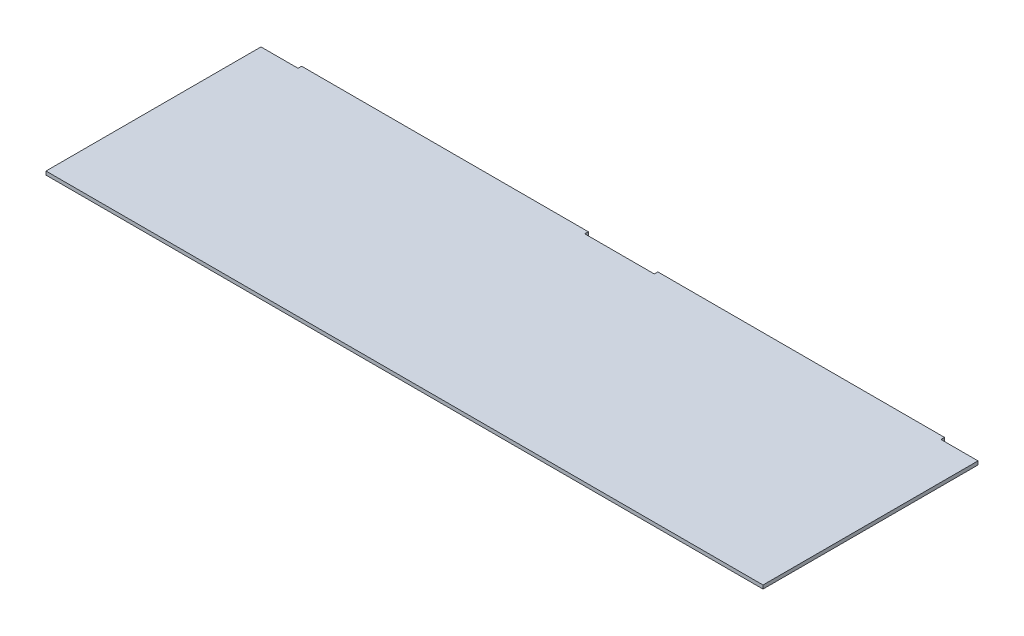
from build123d import *

# Parameters (mm, degrees)
SKETCH1_W           = 635.3556
SKETCH1_H           = 190.5
BOSS_EXTRUDE1_DEPTH = 1.5875
SKETCH2_W           = 254
SKETCH2_H           = 3.175
BOSS_EXTRUDE2_DEPTH = 3.175


with BuildPart() as part:
    # Sketch1 → Boss-Extrude1 (new, symmetric)
    with BuildSketch(Plane(origin=(0, 0, 0), x_dir=(1, 0, 0), z_dir=(0, 1, 0))):
        Rectangle(SKETCH1_W, SKETCH1_H)
    extrude(amount=BOSS_EXTRUDE1_DEPTH, both=True)

    # Sketch2 → Boss-Extrude2 (add)
    with BuildSketch(Plane(origin=(0, 0, -95.25), x_dir=(-1, 0, 0), z_dir=(0, 0, -1))):
        with Locations((-157.8229, 0)):
            Rectangle(SKETCH2_W, SKETCH2_H)
        with Locations((157.8229, 0)):
            Rectangle(SKETCH2_W, SKETCH2_H)
    extrude(amount=BOSS_EXTRUDE2_DEPTH)


solid = part.part
